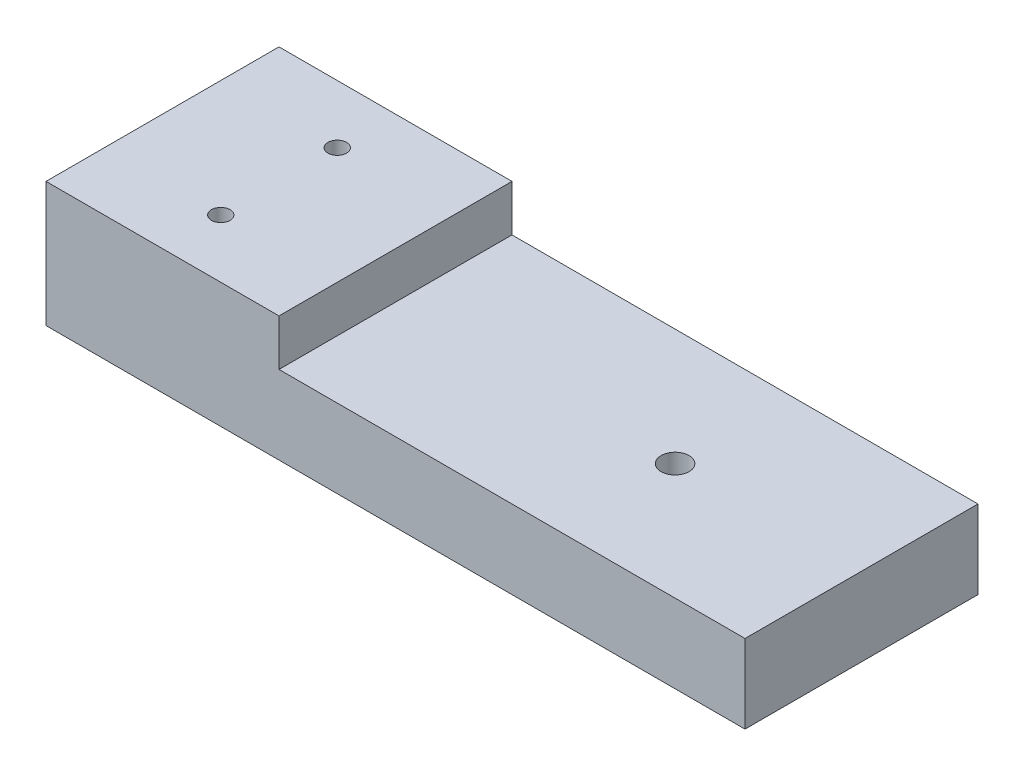
from build123d import *

# Parameters (mm, degrees)
SKETCH1_W           = 50
SKETCH1_H           = 50
BOSS_EXTRUDE1_DEPTH = 26.8
SKETCH1_3_W         = 100
SKETCH1_3_H         = 50
BOSS_EXTRUDE2_DEPTH = 16.85
SKETCH2_R           = 2
SKETCH2_R_2         = 3
CUT_EXTRUDE1_DEPTH  = 161.369074325


with BuildPart() as part:
    # Sketch1 → Boss-Extrude1 (new body)
    with BuildSketch(Plane(origin=(0, 0, 0), x_dir=(1, 0, 0), z_dir=(0, 1, 0))):
        with Locations((25, 25)):
            Rectangle(SKETCH1_W, SKETCH1_H)
    extrude(amount=BOSS_EXTRUDE1_DEPTH)

    # Sketch1<3> → Boss-Extrude2 (add)
    with BuildSketch(Plane(origin=(0, 0, 0), x_dir=(1, 0, 0), z_dir=(0, 1, 0))):
        with Locations((100, 25)):
            Rectangle(SKETCH1_3_W, SKETCH1_3_H)
    extrude(amount=BOSS_EXTRUDE2_DEPTH)

    # Sketch2 → Cut-Extrude1 (cut, through all)
    with BuildSketch(Plane.XZ):
        with Locations((25, -37.5)):
            Circle(SKETCH2_R)
        with Locations((25, -12.5)):
            Circle(SKETCH2_R)
        with Locations((110, -25)):
            Circle(SKETCH2_R_2)
    extrude(amount=-CUT_EXTRUDE1_DEPTH, mode=Mode.SUBTRACT)


solid = part.part
